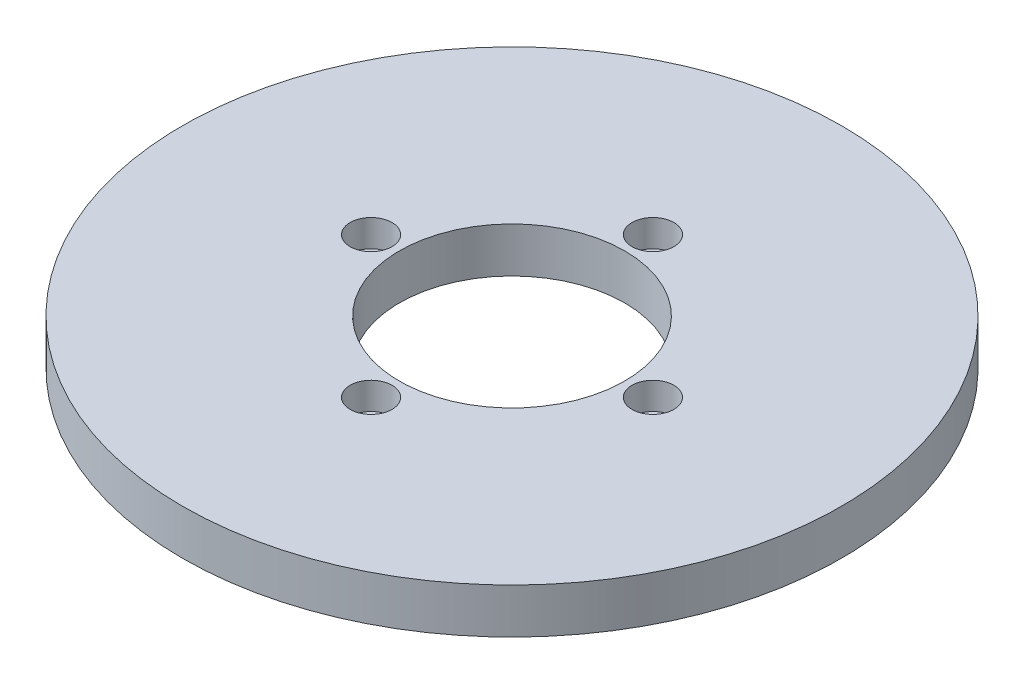
from build123d import *

# Parameters (mm, degrees)
SKETCH1_R           = 95
BOSS_EXTRUDE1_DEPTH = 13
SKETCH2_R           = 32.5
CUT_EXTRUDE1_DEPTH  = 135.977775948
SKETCH3_R           = 6.03825694
CUT_EXTRUDE2_DEPTH  = 7.815070398
CIRPATTERN1_COUNT   = 4


with BuildPart() as part:
    # Sketch1 → Boss-Extrude1 (new body)
    with BuildSketch(Plane(origin=(0, 0, 0), x_dir=(1, 0, 0), z_dir=(0, 1, 0))):
        Circle(SKETCH1_R)
    extrude(amount=BOSS_EXTRUDE1_DEPTH)

    # Sketch2 → Cut-Extrude1 (cut, through all)
    with BuildSketch(Plane(origin=(0, 0, 0), x_dir=(1, 0, 0), z_dir=(0, 1, 0))):
        Circle(SKETCH2_R)
    extrude(amount=CUT_EXTRUDE1_DEPTH, mode=Mode.SUBTRACT)

    # Sketch3 → Cut-Extrude2 (cut)
    with BuildSketch(Plane(origin=(0, 13, 0), x_dir=(1, 0, 0), z_dir=(0, 1, 0))):
        with Locations((-40.6280725, 0)):
            Circle(SKETCH3_R)
    cut_extrude2 = extrude(amount=-CUT_EXTRUDE2_DEPTH, mode=Mode.SUBTRACT)

    # CirPattern1: Cut-Extrude2 ×4 about axis
    cirpattern1_axis = Axis((0, 0, 0), (0, 1, 0))
    for i in range(1, CIRPATTERN1_COUNT):
        add(cut_extrude2.rotate(cirpattern1_axis, i * 360 / CIRPATTERN1_COUNT), mode=Mode.SUBTRACT)


solid = part.part
